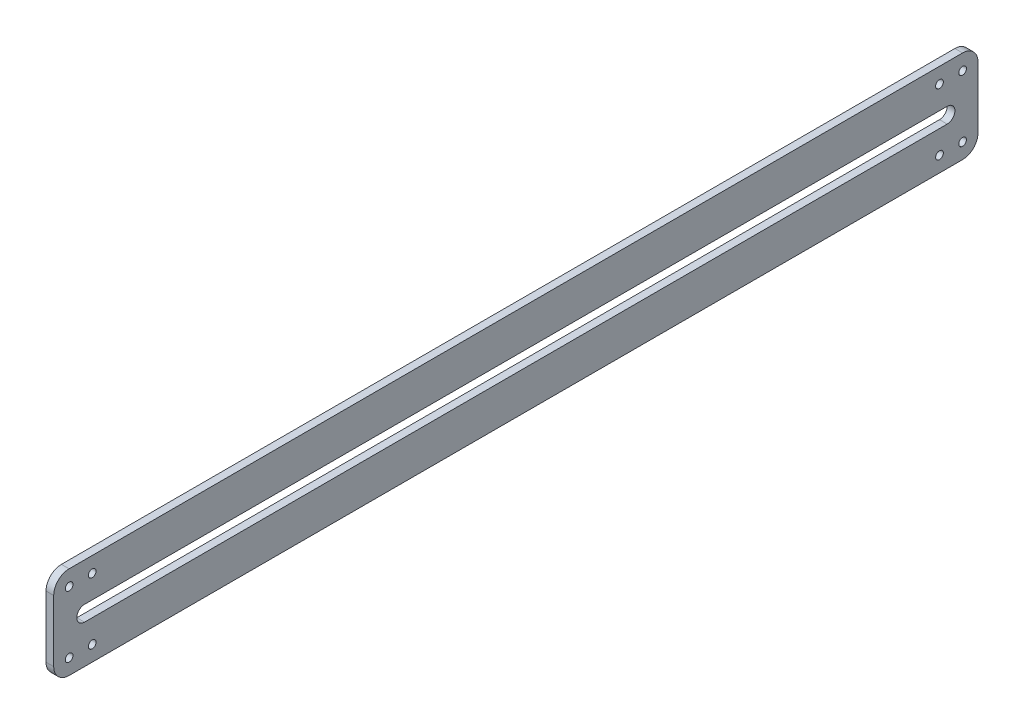
from build123d import *

# Parameters (mm, degrees)
OUTER_CUT_DEPTH   = 1.5875
SLOTS_DEPTH       = 192.476455798
SKETCH3_R         = 1.5875
MOUNT_HOLES_DEPTH = 192.476455798


with BuildPart() as part:
    # Sketch1 → Outer Cut (new, symmetric)
    with BuildSketch(Plane(origin=(0, 0, 0), x_dir=(0, 0, -1), z_dir=(1, 0, 0))):
        with BuildLine():
            Line((-184.15, -19.05), (184.15, -19.05))
            ThreePointArc((184.15, -19.05), (188.640128061, -17.190128061), (190.5, -12.7))
            Line((190.5, -12.7), (190.5, 12.7))
            ThreePointArc((190.5, 12.7), (188.640128061, 17.190128061), (184.15, 19.05))
            Line((184.15, 19.05), (-184.15, 19.05))
            ThreePointArc((-184.15, 19.05), (-188.640128061, 17.190128061), (-190.5, 12.7))
            Line((-190.5, 12.7), (-190.5, -12.7))
            ThreePointArc((-190.5, -12.7), (-188.640128061, -17.190128061), (-184.15, -19.05))
        make_face()
    extrude(amount=OUTER_CUT_DEPTH, both=True)

    # Sketch2 → Slots (cut, through all)
    with BuildSketch(Plane(origin=(1.5875, 0, 0), x_dir=(0, 0, -1), z_dir=(1, 0, 0))):
        with BuildLine():
            Line((-177.8, 3.175), (177.8, 3.175))
            ThreePointArc((177.8, 3.175), (180.975, 0), (177.8, -3.175))
            Line((177.8, -3.175), (-177.8, -3.175))
            ThreePointArc((-177.8, -3.175), (-180.975, 0), (-177.8, 3.175))
        make_face()
    extrude(amount=-SLOTS_DEPTH, mode=Mode.SUBTRACT)

    # Sketch3 → Mount Holes (cut, through all)
    with BuildSketch(Plane(origin=(1.5875, 0, 0), x_dir=(0, 0, -1), z_dir=(1, 0, 0))):
        with Locations((-184.15, 12.7)):
            Circle(SKETCH3_R)
        with Locations((-174.625, 12.7)):
            Circle(SKETCH3_R)
        with Locations((-174.625, -12.7)):
            Circle(SKETCH3_R)
        with Locations((-184.15, -12.7)):
            Circle(SKETCH3_R)
        with Locations((174.625, 12.7)):
            Circle(SKETCH3_R)
        with Locations((184.15, 12.7)):
            Circle(SKETCH3_R)
        with Locations((184.15, -12.7)):
            Circle(SKETCH3_R)
        with Locations((174.625, -12.7)):
            Circle(SKETCH3_R)
    extrude(amount=-MOUNT_HOLES_DEPTH, mode=Mode.SUBTRACT)


solid = part.part
